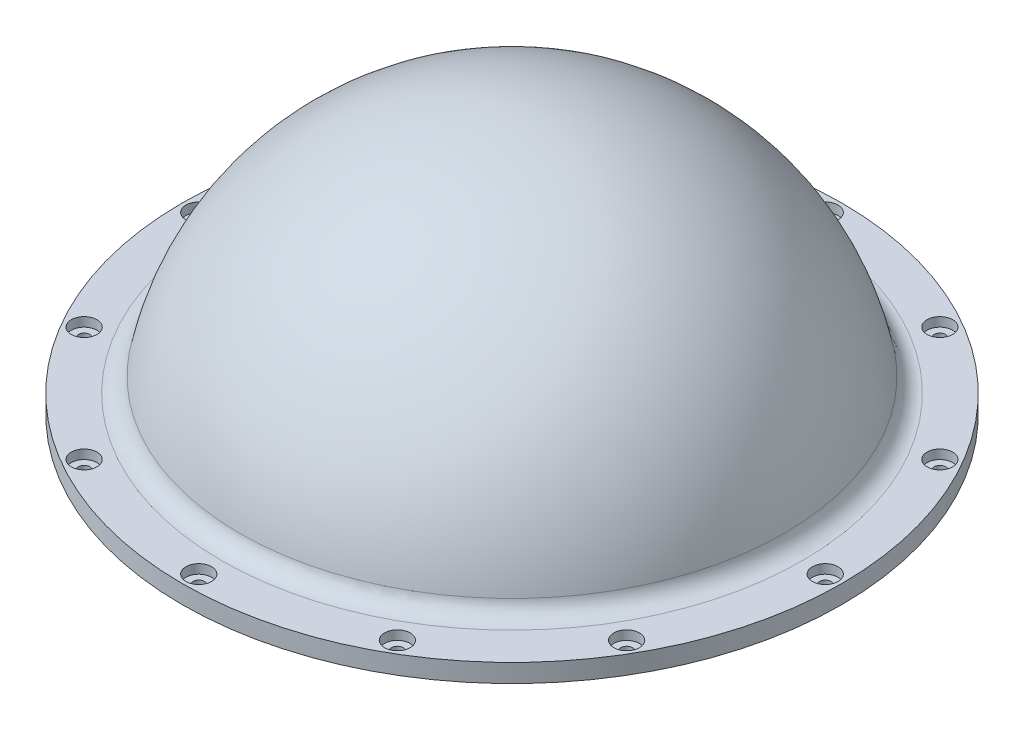
from build123d import *

# Parameters (mm, degrees)
SKETCH1_R           = 90
SKETCH1_R_2         = 71.5
BOSS_EXTRUDE1_DEPTH = 5
SKETCH1_4_R         = 1.55
CUT_EXTRUDE1_DEPTH  = 5
SKETCH1_5_R         = 3.5
SKETCH1_5_R_2       = 1.55
CUT_EXTRUDE2_DEPTH  = 2.5
FILLET1_R           = 5


with BuildPart() as part:
    # Sketch1 → Boss-Extrude1 (new body)
    with BuildSketch(Plane(origin=(0, 0, 0), x_dir=(1, 0, 0), z_dir=(0, 1, 0))):
        with Locations(Location((0, 0, 0), (0, 0, 270))):
            Circle(SKETCH1_R)
        with Locations(Location((0, 0, 0), (0, 0, 270))):
            Circle(SKETCH1_R_2, mode=Mode.SUBTRACT)
    extrude(amount=-BOSS_EXTRUDE1_DEPTH)

    # Sketch1<4> → Cut-Extrude1 (cut)
    with BuildSketch(Plane(origin=(0, 0, 0), x_dir=(1, 0, 0), z_dir=(0, 1, 0))):
        with Locations(Location((0, -85.5, 0), (0, 0, 270))):
            Circle(SKETCH1_4_R)
        with Locations(Location((-74.045172024, -42.75, 0), (0, 0, 270))):
            Circle(SKETCH1_4_R)
        with Locations(Location((-42.75, -74.045172024, 0), (0, 0, 270))):
            Circle(SKETCH1_4_R)
        with Locations(Location((-85.5, 0, 0), (0, 0, 270))):
            Circle(SKETCH1_4_R)
        with Locations(Location((-74.045172024, 42.75, 0), (0, 0, 270))):
            Circle(SKETCH1_4_R)
        with Locations(Location((-42.75, 74.045172024, 0), (0, 0, 270))):
            Circle(SKETCH1_4_R)
        with Locations(Location((0, 85.5, 0), (0, 0, 270))):
            Circle(SKETCH1_4_R)
        with Locations(Location((42.75, 74.045172024, 0), (0, 0, 270))):
            Circle(SKETCH1_4_R)
        with Locations(Location((74.045172024, 42.75, 0), (0, 0, 270))):
            Circle(SKETCH1_4_R)
        with Locations(Location((85.5, 0, 0), (0, 0, 270))):
            Circle(SKETCH1_4_R)
        with Locations(Location((74.045172024, -42.75, 0), (0, 0, 270))):
            Circle(SKETCH1_4_R)
        with Locations(Location((42.75, -74.045172024, 0), (0, 0, 270))):
            Circle(SKETCH1_4_R)
    extrude(amount=-CUT_EXTRUDE1_DEPTH, mode=Mode.SUBTRACT)

    # Sketch1<5> → Cut-Extrude2 (cut)
    # profile 1 of 12: a face of its own
    with BuildSketch(Plane(origin=(0, 0, 0), x_dir=(1, 0, 0), z_dir=(0, 1, 0))):
        with Locations(Location((-74.045172024, -42.75, 0), (0, 0, 270))):
            Circle(SKETCH1_5_R)
        with Locations(Location((-74.045172024, -42.75, 0), (0, 0, 270))):
            Circle(SKETCH1_5_R_2, mode=Mode.SUBTRACT)
    # profile 2 of 12: a face of its own
    with BuildSketch(Plane(origin=(0, 0, 0), x_dir=(1, 0, 0), z_dir=(0, 1, 0))):
        with Locations(Location((-85.5, 0, 0), (0, 0, 270))):
            Circle(SKETCH1_5_R)
        with Locations(Location((-85.5, 0, 0), (0, 0, 270))):
            Circle(SKETCH1_5_R_2, mode=Mode.SUBTRACT)
    # profile 3 of 12: a face of its own
    with BuildSketch(Plane(origin=(0, 0, 0), x_dir=(1, 0, 0), z_dir=(0, 1, 0))):
        with Locations(Location((-42.75, -74.045172024, 0), (0, 0, 270))):
            Circle(SKETCH1_5_R)
        with Locations(Location((-42.75, -74.045172024, 0), (0, 0, 270))):
            Circle(SKETCH1_5_R_2, mode=Mode.SUBTRACT)
    # profile 4 of 12: a face of its own
    with BuildSketch(Plane(origin=(0, 0, 0), x_dir=(1, 0, 0), z_dir=(0, 1, 0))):
        with Locations(Location((0, -85.5, 0), (0, 0, 270))):
            Circle(SKETCH1_5_R)
        with Locations(Location((0, -85.5, 0), (0, 0, 270))):
            Circle(SKETCH1_5_R_2, mode=Mode.SUBTRACT)
    # profile 5 of 12: a face of its own
    with BuildSketch(Plane(origin=(0, 0, 0), x_dir=(1, 0, 0), z_dir=(0, 1, 0))):
        with Locations(Location((-74.045172024, 42.75, 0), (0, 0, 270))):
            Circle(SKETCH1_5_R)
        with Locations(Location((-74.045172024, 42.75, 0), (0, 0, 270))):
            Circle(SKETCH1_5_R_2, mode=Mode.SUBTRACT)
    # profile 6 of 12: a face of its own
    with BuildSketch(Plane(origin=(0, 0, 0), x_dir=(1, 0, 0), z_dir=(0, 1, 0))):
        with Locations(Location((-42.75, 74.045172024, 0), (0, 0, 270))):
            Circle(SKETCH1_5_R)
        with Locations(Location((-42.75, 74.045172024, 0), (0, 0, 270))):
            Circle(SKETCH1_5_R_2, mode=Mode.SUBTRACT)
    # profile 7 of 12: a face of its own
    with BuildSketch(Plane(origin=(0, 0, 0), x_dir=(1, 0, 0), z_dir=(0, 1, 0))):
        with Locations(Location((0, 85.5, 0), (0, 0, 270))):
            Circle(SKETCH1_5_R)
        with Locations(Location((0, 85.5, 0), (0, 0, 270))):
            Circle(SKETCH1_5_R_2, mode=Mode.SUBTRACT)
    # profile 8 of 12: a face of its own
    with BuildSketch(Plane(origin=(0, 0, 0), x_dir=(1, 0, 0), z_dir=(0, 1, 0))):
        with Locations(Location((74.045172024, 42.75, 0), (0, 0, 270))):
            Circle(SKETCH1_5_R)
        with Locations(Location((74.045172024, 42.75, 0), (0, 0, 270))):
            Circle(SKETCH1_5_R_2, mode=Mode.SUBTRACT)
    # profile 9 of 12: a face of its own
    with BuildSketch(Plane(origin=(0, 0, 0), x_dir=(1, 0, 0), z_dir=(0, 1, 0))):
        with Locations(Location((42.75, 74.045172024, 0), (0, 0, 270))):
            Circle(SKETCH1_5_R)
        with Locations(Location((42.75, 74.045172024, 0), (0, 0, 270))):
            Circle(SKETCH1_5_R_2, mode=Mode.SUBTRACT)
    # profile 10 of 12: a face of its own
    with BuildSketch(Plane(origin=(0, 0, 0), x_dir=(1, 0, 0), z_dir=(0, 1, 0))):
        with Locations(Location((74.045172024, -42.75, 0), (0, 0, 270))):
            Circle(SKETCH1_5_R)
        with Locations(Location((74.045172024, -42.75, 0), (0, 0, 270))):
            Circle(SKETCH1_5_R_2, mode=Mode.SUBTRACT)
    # profile 11 of 12: a face of its own
    with BuildSketch(Plane(origin=(0, 0, 0), x_dir=(1, 0, 0), z_dir=(0, 1, 0))):
        with Locations(Location((85.5, 0, 0), (0, 0, 270))):
            Circle(SKETCH1_5_R)
        with Locations(Location((85.5, 0, 0), (0, 0, 270))):
            Circle(SKETCH1_5_R_2, mode=Mode.SUBTRACT)
    # profile 12 of 12: a face of its own
    with BuildSketch(Plane(origin=(0, 0, 0), x_dir=(1, 0, 0), z_dir=(0, 1, 0))):
        with Locations(Location((42.75, -74.045172024, 0), (0, 0, 270))):
            Circle(SKETCH1_5_R)
        with Locations(Location((42.75, -74.045172024, 0), (0, 0, 270))):
            Circle(SKETCH1_5_R_2, mode=Mode.SUBTRACT)
    extrude(amount=-CUT_EXTRUDE2_DEPTH, mode=Mode.SUBTRACT)

    # Sketch2 → Revolve1 (revolve)
    with BuildSketch(Plane.XY, mode=Mode.PRIVATE) as revolve1_sk:
        with BuildLine():
            Line((0, 65), (0, 62))
            ThreePointArc((0, 62), (47.507894081, 44.364006029), (72, 0))
            Line((72, 0), (75, 0))
            ThreePointArc((75, 0), (49.623583103, 46.488749734), (0, 65))
        make_face()
    revolve(revolve1_sk.sketch.rotate(Axis((0, 0, 0), (0, 1, 0)), 180), axis=Axis((0, 0, 0), (0, 1, 0)))

    # Fillet1
    fillet1_edges = [part.edges().sort_by_distance(p)[0] for p in [
        (75, 0, 0),
        (0, -5, -71.5),
    ]]
    fillet(fillet1_edges, radius=FILLET1_R - 0.0001)  # a hair under: the kernel refuses the full size


solid = part.part
